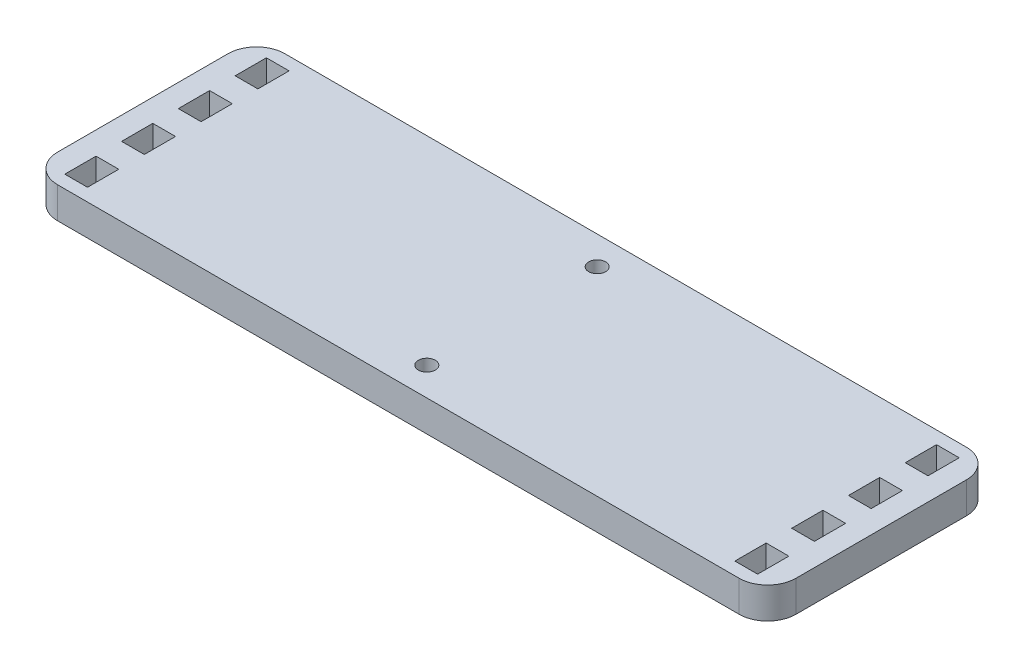
from build123d import *

# Parameters (mm, degrees)
SKETCH1_W           = 130
SKETCH1_H           = 40
SKETCH1_R           = 1.5
BOSS_EXTRUDE1_DEPTH = 5.5
SKETCH2_W           = 4
SKETCH2_H           = 5.5
CUT_EXTRUDE1_DEPTH  = 69.229392493
FILLET1_R           = 5


with BuildPart() as part:
    # Sketch1 → Boss-Extrude1 (new body)
    with BuildSketch(Plane(origin=(0, 0, 0), x_dir=(1, 0, 0), z_dir=(0, 1, 0))):
        Rectangle(SKETCH1_W, SKETCH1_H)
        with Locations((0, 15)):
            Circle(SKETCH1_R, mode=Mode.SUBTRACT)
        with Locations((0, -15)):
            Circle(SKETCH1_R, mode=Mode.SUBTRACT)
    extrude(amount=BOSS_EXTRUDE1_DEPTH)

    # Sketch2 → Cut-Extrude1 (cut, through all)
    with BuildSketch(Plane(origin=(0, 5.5, 0), x_dir=(1, 0, 0), z_dir=(0, 1, 0))):
        with Locations((-59, 5)):
            Rectangle(SKETCH2_W, SKETCH2_H)
        with Locations((-59, 15)):
            Rectangle(SKETCH2_W, SKETCH2_H)
        with Locations((-59, -5)):
            Rectangle(SKETCH2_W, SKETCH2_H)
        with Locations((-59, -15)):
            Rectangle(SKETCH2_W, SKETCH2_H)
        with Locations((59, -15)):
            Rectangle(SKETCH2_W, SKETCH2_H)
        with Locations((59, 15)):
            Rectangle(SKETCH2_W, SKETCH2_H)
        with Locations((59, -5)):
            Rectangle(SKETCH2_W, SKETCH2_H)
        with Locations((59, 5)):
            Rectangle(SKETCH2_W, SKETCH2_H)
    extrude(amount=-CUT_EXTRUDE1_DEPTH, mode=Mode.SUBTRACT)

    # Fillet1
    fillet1_edges = [part.edges().sort_by_distance(p)[0] for p in [
        (65, 2.75, -20),
        (-65, 2.75, -20),
        (-65, 2.75, 20),
        (65, 2.75, 20),
    ]]
    fillet(fillet1_edges, radius=FILLET1_R)


solid = part.part
